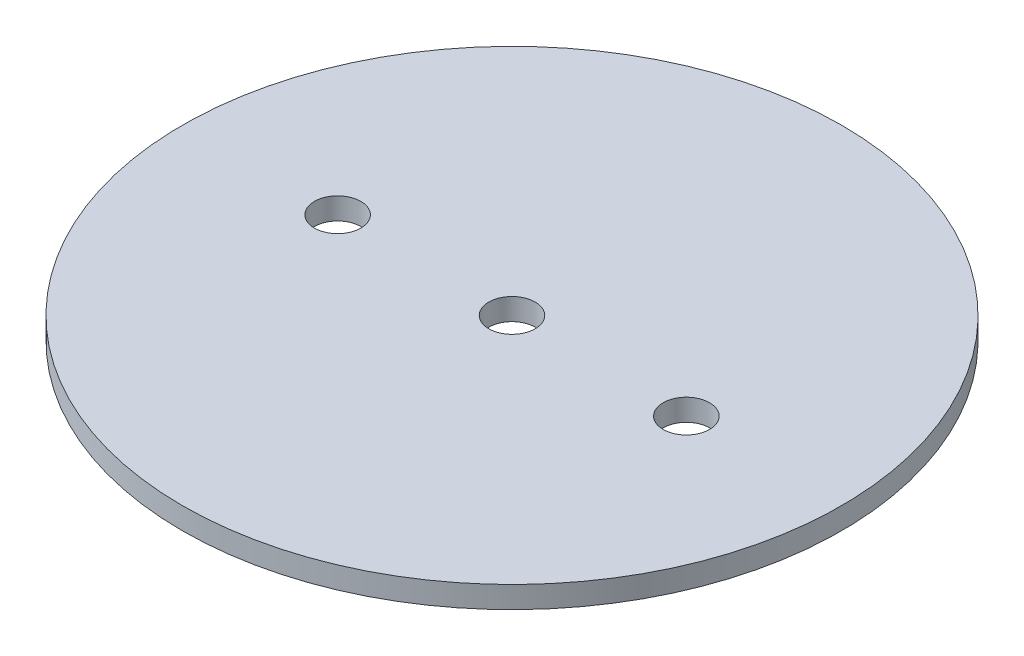
from build123d import *

# Parameters (mm, degrees)
SKETCH1_R               = 48.006
BOSS_EXTRUDE1_DEPTH     = 3.175
F_1_4_CLEARANCE_HOLE1_D = 6.7564


with BuildPart() as part:
    # Sketch1 → Boss-Extrude1 (new body)
    with BuildSketch(Plane(origin=(0, 0, 0), x_dir=(1, 0, 0), z_dir=(0, 1, 0))):
        Circle(SKETCH1_R)
    extrude(amount=BOSS_EXTRUDE1_DEPTH)

    # 1/4 Clearance Hole1 (through all)
    with Locations(Plane(origin=(0, 0, 0), x_dir=(-1, 0, 0), z_dir=(0, -1, 0))):
        with Locations((-25.4, 0), (0, 0), (25.4, 0)):
            Hole(F_1_4_CLEARANCE_HOLE1_D / 2)


solid = part.part
